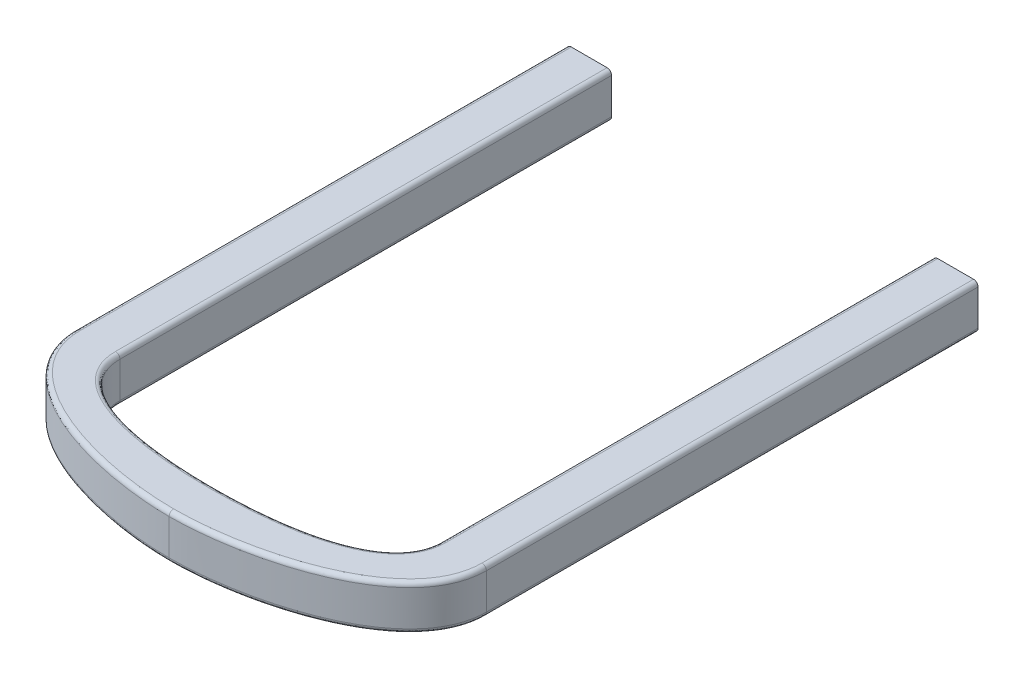
from build123d import *

# Parameters (mm, degrees)
SKETCH1_W           = 0.5
SKETCH1_H           = 0.5
BOSS_EXTRUDE1_DEPTH = 5.5
LOFT1_START         = -0.25
LOFT1_DEPTH         = 0.5
FILLET1_R           = 0.05


# Read off the part's stored shape, not the designer's step: Loft1
with BuildPart() as part:
    # Sketch1 → Boss-Extrude1 (new body)
    with BuildSketch(Plane.XY):
        with Locations((2.05, 0)):
            Rectangle(SKETCH1_W, SKETCH1_H)
    extrude(amount=BOSS_EXTRUDE1_DEPTH)

    # Loft1 outline → Loft1 (add)
    with BuildSketch(Plane(origin=(0, 0, 0), x_dir=(1, 0, 0), z_dir=(0, 1, 0)).offset(LOFT1_START)):
        with BuildLine():
            Line((0, -6.25), (0, -6.75))
            add(Edge.make_bspline(
                [(0, -6.75), (0.872576008, -6.75), (2.3, -6.372576008), (2.3, -5.5)],
                knots=[0, 0, 0, 0, 1, 1, 1, 1], degree=3))
            Line((2.3, -5.5), (1.8, -5.5))
            add(Edge.make_bspline(
                [(0, -6.25), (0.65, -6.25), (1.8, -6.15), (1.8, -5.5)],
                knots=[0, 0, 0, 0, 1, 1, 1, 1], degree=3))
        make_face()
    extrude(amount=LOFT1_DEPTH)

    # Fillet1
    fillet1_edges = [part.edges().sort_by_distance(p)[0] for p in [
        (1.055742962, -0.25, 6.142238814),
        (1.055742962, -0.25, 6.142238814),
        (1.055742962, 0.25, 6.142238814),
        (2.3, 0.25, 2.75),
        (2.3, -0.25, 2.75),
        (1.8, -0.25, 2.75),
        (1.8, 0.25, 2.75),
        (1.055742962, 0.25, 6.142238814),
    ]]
    fillet(fillet1_edges, radius=FILLET1_R)

    # Mirror1: part across plane


with BuildPart() as part_1:
    add(part.part)
    add(part.part.mirror(Plane(origin=(0, 0, 0), x_dir=(0, 0, 1), z_dir=(1, 0, 0))))


solid = part_1.part
